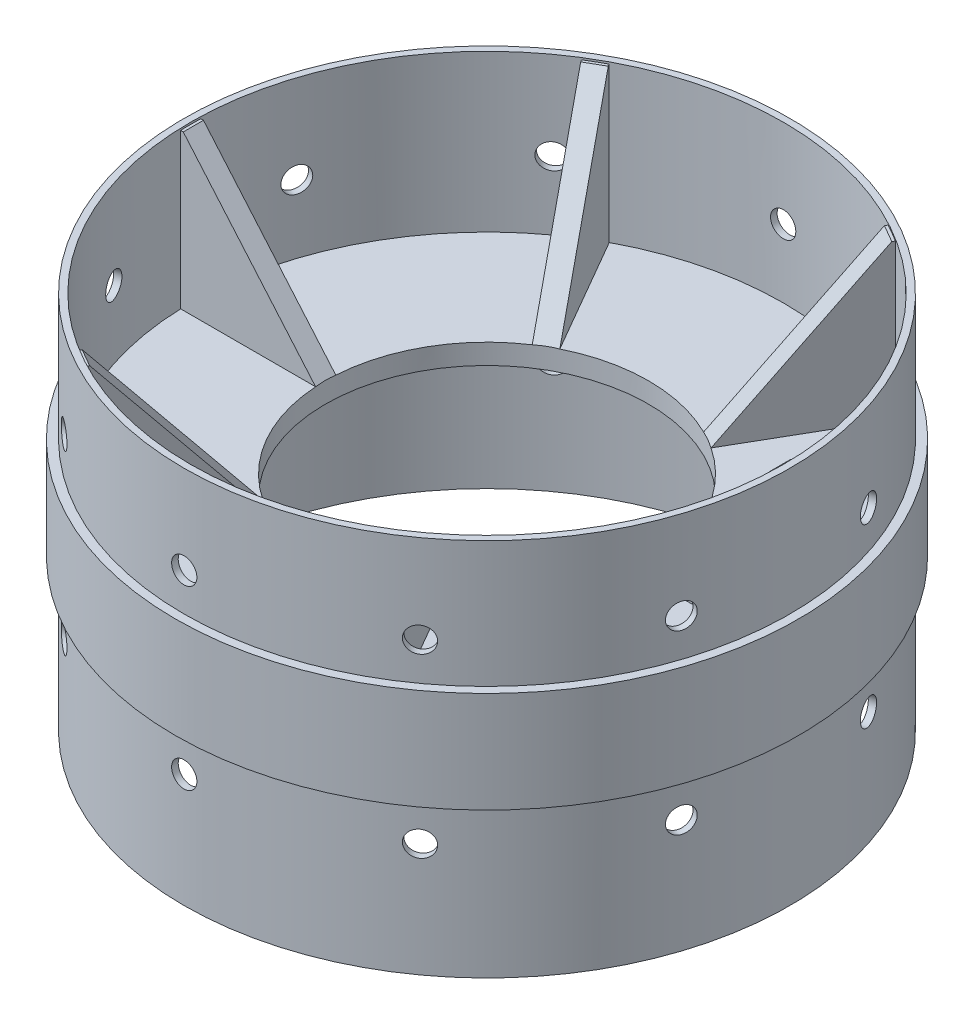
from build123d import *

# Parameters (mm, degrees)
SKETCH1_R            = 78.359
SKETCH1_R_2          = 74.549
BOSS_EXTRUDE1_DEPTH  = 25.4
SKETCH2_R            = 76.2
SKETCH2_R_2          = 74.549
BOSS_EXTRUDE2_DEPTH  = 31.75
BOSS_EXTRUDE3_START  = 38.1
SKETCH3_R            = 76.2
SKETCH3_R_2          = 74.549
BOSS_EXTRUDE3_DEPTH  = 38.1
SKETCH4_R            = 74.549
SKETCH4_R_2          = 40.64
BOSS_EXTRUDE4_DEPTH  = 5.08
BOSS_EXTRUDE10_DEPTH = 38.862
CUT_EXTRUDE1_DEPTH   = 5.08
CIRPATTERN1_COUNT    = 6
SKETCH7_R            = 3.175
CUT_EXTRUDE2_DEPTH   = 125.685156542
CIRPATTERN2_COUNT    = 10


with BuildPart() as part:
    # Sketch1 → Boss-Extrude1 (new body)
    with BuildSketch(Plane(origin=(0, 0, 0), x_dir=(1, 0, 0), z_dir=(0, 1, 0))):
        Circle(SKETCH1_R)
        Circle(SKETCH1_R_2, mode=Mode.SUBTRACT)
    extrude(amount=BOSS_EXTRUDE1_DEPTH)

    # Sketch2 → Boss-Extrude2 (add)
    with BuildSketch(Plane(origin=(0, 25.4, 0), x_dir=(1, 0, 0), z_dir=(0, 1, 0))):
        Circle(SKETCH2_R)
        Circle(SKETCH2_R_2, mode=Mode.SUBTRACT)
    extrude(amount=BOSS_EXTRUDE2_DEPTH)

    # Sketch3 → Boss-Extrude3 (add)
    with BuildSketch(Plane.XZ.offset(BOSS_EXTRUDE3_START)):
        Circle(SKETCH3_R)
        Circle(SKETCH3_R_2, mode=Mode.SUBTRACT)
    extrude(amount=-BOSS_EXTRUDE3_DEPTH)

    # Sketch4 → Boss-Extrude4 (add)
    with BuildSketch(Plane(origin=(0, 12.7, 0), x_dir=(1, 0, 0), z_dir=(0, 1, 0))):
        Circle(SKETCH4_R)
        Circle(SKETCH4_R_2, mode=Mode.SUBTRACT)
    extrude(amount=BOSS_EXTRUDE4_DEPTH)

    # Sketch5 → Boss-Extrude10 (add)
    with BuildSketch(Plane(origin=(0, 17.78, 0), x_dir=(1, 0, 0), z_dir=(0, 1, 0))):
        with BuildLine():
            Line((40.560547334, 2.54), (74.505716566, 2.54))
            ThreePointArc((74.505716566, 2.54), (74.549, 0), (74.505716566, -2.54))
            Line((74.505716566, -2.54), (40.560547334, -2.54))
            ThreePointArc((40.560547334, -2.54), (40.64, 0), (40.560547334, 2.54))
        make_face()
        with BuildLine():
            Line((22.479978192, -33.856464382), (39.452562809, -63.253843273))
            ThreePointArc((39.452562809, -63.253843273), (37.2745, -64.561327827), (35.053153757, -65.793843273))
            Line((35.053153757, -65.793843273), (18.080569141, -36.396464382))
            ThreePointArc((18.080569141, -36.396464382), (20.32, -35.19527241), (22.479978192, -33.856464382))
        make_face()
        with BuildLine():
            Line((-18.080569141, -36.396464382), (-35.053153757, -65.793843273))
            ThreePointArc((-35.053153757, -65.793843273), (-37.2745, -64.561327827), (-39.452562809, -63.253843273))
            Line((-39.452562809, -63.253843273), (-22.479978192, -33.856464382))
            ThreePointArc((-22.479978192, -33.856464382), (-20.32, -35.19527241), (-18.080569141, -36.396464382))
        make_face()
        with BuildLine():
            Line((-40.560547334, -2.54), (-74.505716566, -2.54))
            ThreePointArc((-74.505716566, -2.54), (-74.549, 0), (-74.505716566, 2.54))
            Line((-74.505716566, 2.54), (-40.560547334, 2.54))
            ThreePointArc((-40.560547334, 2.54), (-40.64, 0), (-40.560547334, -2.54))
        make_face()
        with BuildLine():
            Line((-22.479978192, 33.856464382), (-39.452562809, 63.253843273))
            ThreePointArc((-39.452562809, 63.253843273), (-37.2745, 64.561327827), (-35.053153757, 65.793843273))
            Line((-35.053153757, 65.793843273), (-18.080569141, 36.396464382))
            ThreePointArc((-18.080569141, 36.396464382), (-20.32, 35.19527241), (-22.479978192, 33.856464382))
        make_face()
        with BuildLine():
            Line((18.080569141, 36.396464382), (35.053153757, 65.793843273))
            ThreePointArc((35.053153757, 65.793843273), (37.2745, 64.561327827), (39.452562809, 63.253843273))
            Line((39.452562809, 63.253843273), (22.479978192, 33.856464382))
            ThreePointArc((22.479978192, 33.856464382), (20.32, 35.19527241), (18.080569141, 36.396464382))
        make_face()
    extrude(amount=BOSS_EXTRUDE10_DEPTH)

    # Sketch6 → Cut-Extrude1 (cut)
    with BuildSketch(Plane.XY.offset(2.54)):
        Polygon((74.282769266, 57.15), (40.560547334, 17.78), (40.560547334, 57.15), align=None)
    cut_extrude1 = extrude(amount=-CUT_EXTRUDE1_DEPTH, mode=Mode.SUBTRACT)

    # CirPattern1: Cut-Extrude1 ×6 about axis
    cirpattern1_axis = Axis((0, 12.7, 0), (0, 1, 0))
    for i in range(1, CIRPATTERN1_COUNT):
        add(cut_extrude1.rotate(cirpattern1_axis, i * 360 / CIRPATTERN1_COUNT), mode=Mode.SUBTRACT)

    # Sketch7 → Cut-Extrude2 (cut, through all)
    with BuildSketch(Plane.XY):
        with Locations((0, 34.925)):
            Circle(SKETCH7_R)
        with Locations((0, -9.525)):
            Circle(SKETCH7_R)
    cut_extrude2 = extrude(amount=-CUT_EXTRUDE2_DEPTH, mode=Mode.SUBTRACT)

    # CirPattern2: Cut-Extrude2 ×10 about axis
    cirpattern2_axis = Axis((0, 42.33015195, 0), (0, 1, 0))
    for i in range(1, CIRPATTERN2_COUNT):
        add(cut_extrude2.rotate(cirpattern2_axis, i * 360 / CIRPATTERN2_COUNT), mode=Mode.SUBTRACT)


solid = part.part
